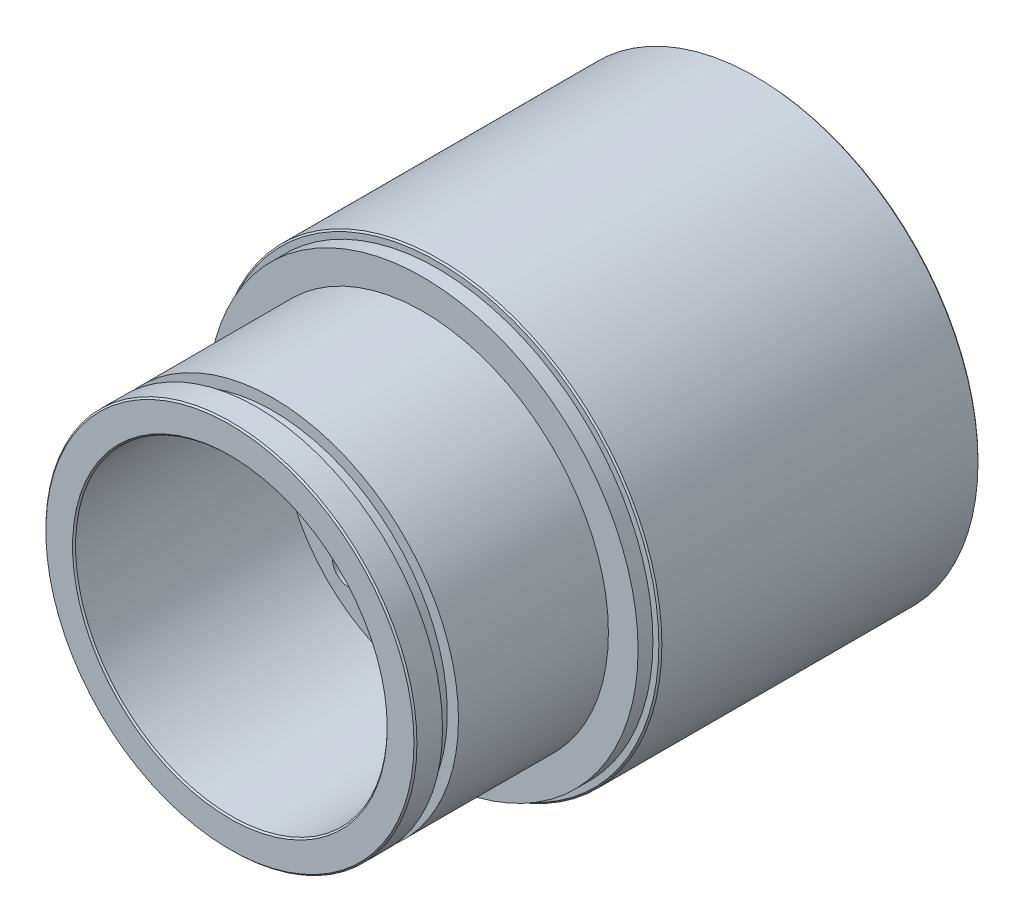
from build123d import *

# Parameters (mm, degrees)
SKETCH2_W            = 1.5
SKETCH2_H            = 2.15
CHAMFER1_SIZE        = 0.2
M4_CLEARANCE_HOLE1_D = 4.3
CIRPATTERN1_COUNT    = 4
CIRPATTERN3_COUNT    = 6


with BuildPart() as part:
    # Sketch1 → Revolve1 (revolve)
    with BuildSketch(Plane(origin=(0, 0, 0), x_dir=(1, 0, 0), z_dir=(0, 1, 0))):
        Polygon((13, 0), (21, 0), (21, -28), (25, -28), (25, -2), (29, -2), (29, 0), (30, 0), (30, 43), (20.5, 43), (20.5, 4), (13, 4), align=None)
    revolve(axis=Axis((0, 0, 0), (0, 0, -1)))

    # Sketch2 → Cut-Revolve1 (revolve, cut)
    with BuildSketch(Plane(origin=(0, 0, 0), x_dir=(1, 0, 0), z_dir=(0, 1, 0))):
        with Locations((24.25, -23.275)):
            Rectangle(SKETCH2_W, SKETCH2_H)
    revolve(axis=Axis((0, 0, 0), (0, 0, 1)), mode=Mode.SUBTRACT)

    # Chamfer1
    chamfer1_edges = [part.edges().sort_by_distance(p)[0] for p in [
        (-30, 0, 0),
        (-20.5, 0, -43),
        (-25, 0, 28),
        (-21, 0, 28),
        (-30, 0, -43),
    ]]
    chamfer(chamfer1_edges, length=CHAMFER1_SIZE)

    # M4 Clearance Hole1 (through all)
    with Locations(Plane.XY):
        with Locations((-12.02081528, 12.02081528)):
            m4_clearance_hole1 = Hole(M4_CLEARANCE_HOLE1_D / 2)

    # CirPattern1: M4 Clearance Hole1 ×4 about axis
    cirpattern1_axis = Axis((0, 0, 0), (0, 0, 1))
    for i in range(1, CIRPATTERN1_COUNT):
        add(m4_clearance_hole1.rotate(cirpattern1_axis, i * 360 / CIRPATTERN1_COUNT), mode=Mode.SUBTRACT)

    # Sketch9 → M4 Tapped Hole1 (revolve, cut)
    with BuildSketch(Plane(origin=(0, 25, -43), x_dir=(0, 1, 0), z_dir=(1, 0, 0))):
        Polygon((0, 0), (0, 11.091420021), (1.65, 10.1), (1.65, 0), align=None)
    m4_tapped_hole1 = revolve(axis=Axis((0, 25, -49.35), (0, 0, 1)), mode=Mode.SUBTRACT)

    # CirPattern3: M4 Tapped Hole1 ×6 about axis
    cirpattern3_axis = Axis((0, 0, 0), (0, 0, 1))
    for i in range(1, CIRPATTERN3_COUNT):
        add(m4_tapped_hole1.rotate(cirpattern3_axis, i * 360 / CIRPATTERN3_COUNT), mode=Mode.SUBTRACT)


solid = part.part
